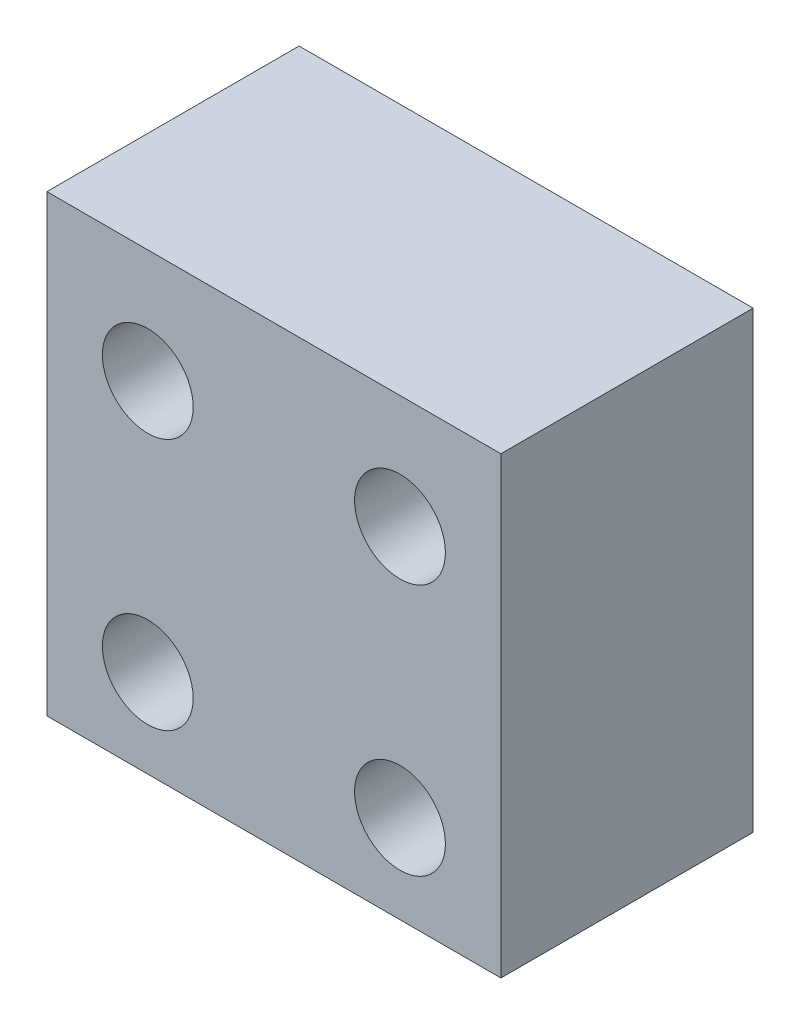
from build123d import *

# Parameters (mm, degrees)
SKETCH1_W            = 18
SKETCH1_H            = 18
BOSS_EXTRUDE1_DEPTH  = 10
M3_CLEARANCE_HOLE1_D = 3.6


with BuildPart() as part:
    # Sketch1 → Boss-Extrude1 (new body)
    with BuildSketch(Plane.XY):
        with Locations((160.000000073, 95.998999469)):
            Rectangle(SKETCH1_W, SKETCH1_H)
    extrude(amount=BOSS_EXTRUDE1_DEPTH)

    # M3 Clearance Hole1 (through all)
    with Locations(Plane.XY.offset(10)):
        with Locations((155.000000073, 100.498999469), (155.000000073, 90.498999469), (165.000000073, 90.498999469), (165.000000073, 100.498999469)):
            Hole(M3_CLEARANCE_HOLE1_D / 2)


solid = part.part
